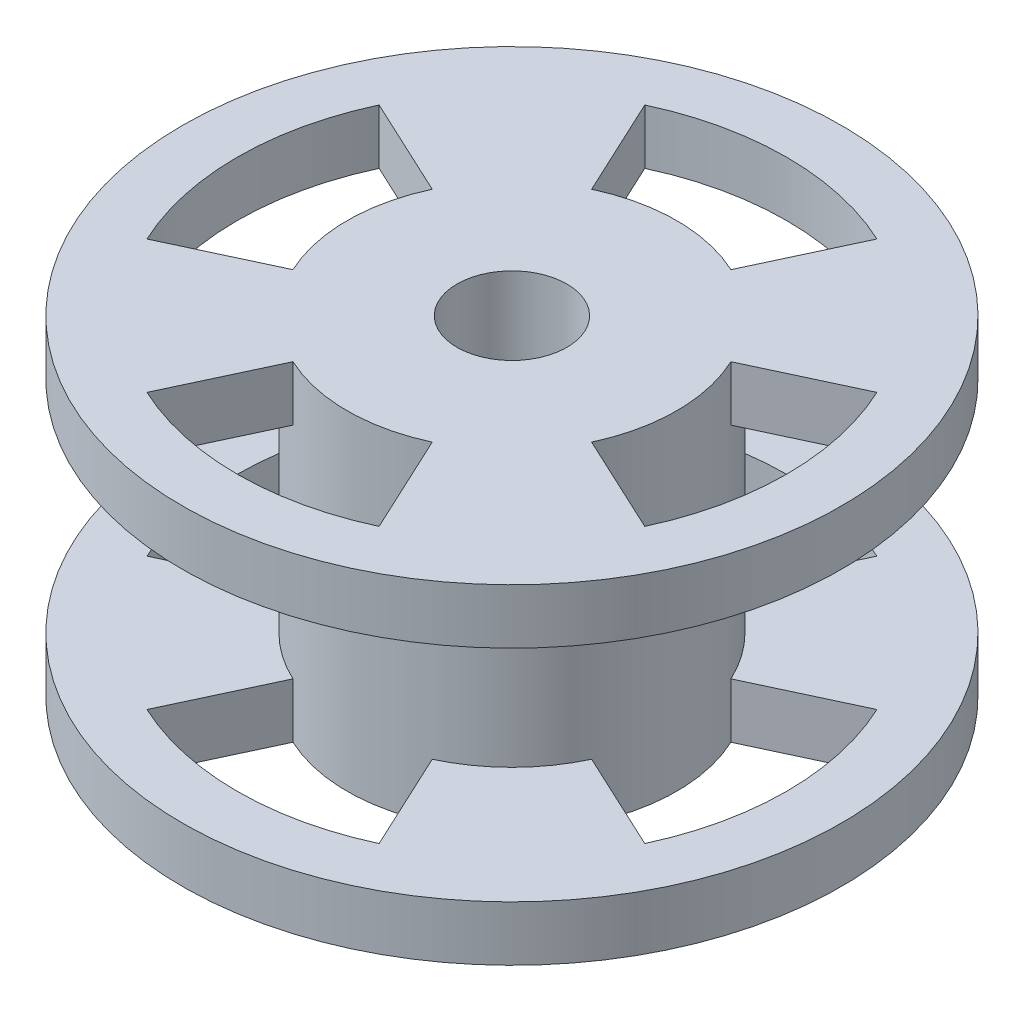
from build123d import *
from build123d.topology import SkipClean

# Parameters (mm, degrees)
CUT_EXTRUDE1_DEPTH = 28.5


with BuildPart() as part:
    # Sketch1 → Revolve2 (revolve)
    with BuildSketch(Plane.XY):
        Polygon((0, 0), (0, 7.5), (0, 15), (12.5, 15), (12.5, 12.5), (5, 12.5), (5, 7.5), (5, 2.5), (12.5, 2.5), (12.5, 0), align=None)
    revolve(axis=Axis((-2.5, 15, 0), (0, -1, 0)))

    # Sketch3 → Cut-Extrude1 (cut, through all)
    with SkipClean():  # the faces are left unmerged after this step: merging them gives an invalid solid
        with BuildSketch(Plane(origin=(0, 15, 0), x_dir=(1, 0, 0), z_dir=(0, 1, 0))):
            with BuildLine():
                Line((-7.782728272, 11.328847338), (-5.669636963, 6.797308403))
                ThreePointArc((-5.669636963, 6.797308403), (-2.5, 7.5), (0.669636963, 6.797308403))
                Line((0.669636963, 6.797308403), (2.782728272, 11.328847338))
                ThreePointArc((2.782728272, 11.328847338), (-2.5, 12.5), (-7.782728272, 11.328847338))
            make_face()
            with BuildLine():
                Line((8.828847338, -5.282728272), (4.297308403, -3.169636963))
                ThreePointArc((4.297308403, -3.169636963), (5, 0), (4.297308403, 3.169636963))
                Line((4.297308403, 3.169636963), (8.828847338, 5.282728272))
                ThreePointArc((8.828847338, 5.282728272), (10, 0), (8.828847338, -5.282728272))
            make_face()
            with BuildLine():
                Line((-7.782728272, -11.328847338), (-5.669636963, -6.797308403))
                ThreePointArc((-5.669636963, -6.797308403), (-2.5, -7.5), (0.669636963, -6.797308403))
                Line((0.669636963, -6.797308403), (2.782728272, -11.328847338))
                ThreePointArc((2.782728272, -11.328847338), (-2.5, -12.5), (-7.782728272, -11.328847338))
            make_face()
            with BuildLine():
                Line((-13.828847338, 5.282728272), (-9.297308403, 3.169636963))
                ThreePointArc((-9.297308403, 3.169636963), (-10, 0), (-9.297308403, -3.169636963))
                Line((-9.297308403, -3.169636963), (-13.828847338, -5.282728272))
                ThreePointArc((-13.828847338, -5.282728272), (-15, 0), (-13.828847338, 5.282728272))
            make_face()
        extrude(amount=-CUT_EXTRUDE1_DEPTH, mode=Mode.SUBTRACT)


solid = part.part
